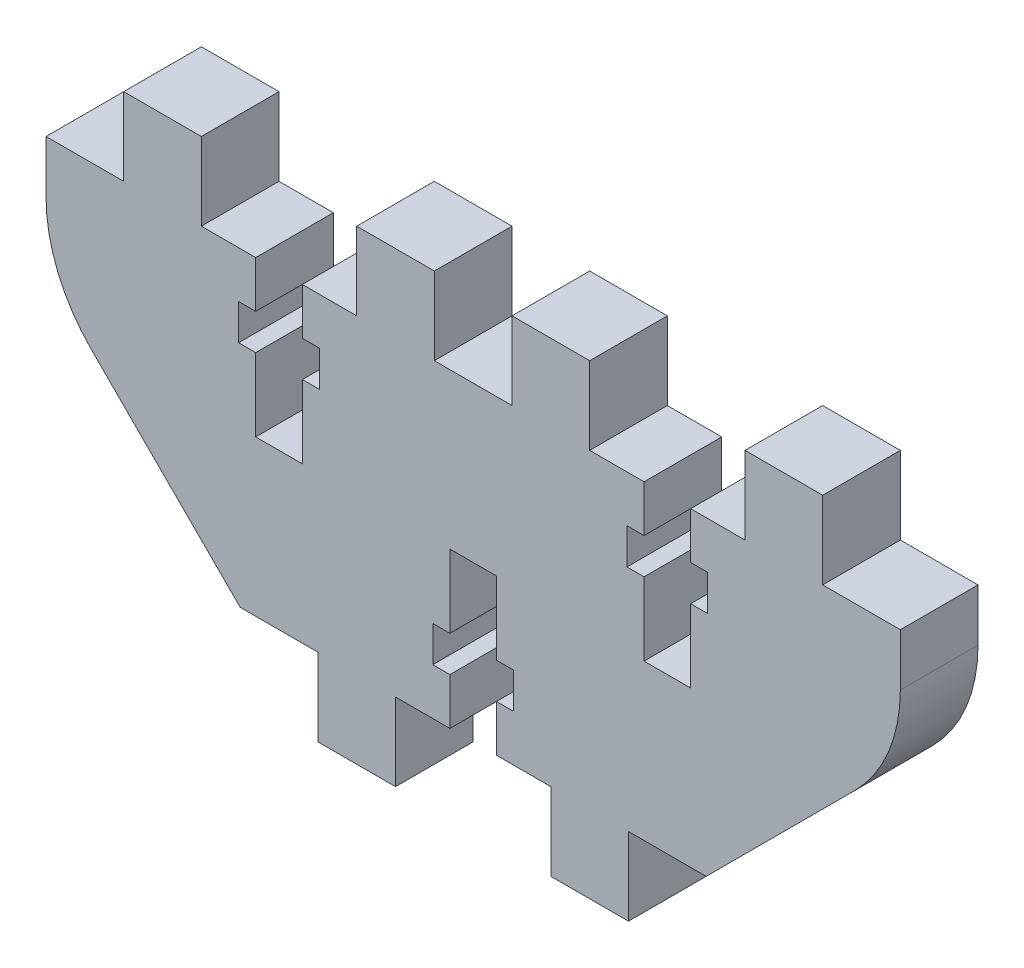
from build123d import *

# Parameters (mm, degrees)
BOSS_EXTRU_1_DEPTH = 5
CONG_1_R           = 10


with BuildPart() as part:
    # Esquisse1 → Boss.-Extru.1 (new body)
    with BuildSketch(Plane.XY):
        Polygon((10, 0), (15, 0), (27.5, 12.5), (27.5, 20), (22.5, 20), (22.5, 25), (17.5, 25), (17.5, 20), (14, 20), (14, 17), (15.1, 17), (15.1, 14.7), (14, 14.7), (14, 10), (11, 10), (11, 14.7), (9.9, 14.7), (9.9, 17), (11, 17), (11, 20), (7.5, 20), (7.5, 25), (2.5, 25), (2.5, 20), (-2.5, 20), (-2.5, 25), (-7.5, 25), (-7.5, 20), (-11, 20), (-11, 17), (-9.9, 17), (-9.9, 14.7), (-11, 14.7), (-11, 10), (-14, 10), (-14, 14.7), (-15.1, 14.7), (-15.1, 17), (-14, 17), (-14, 20), (-17.5, 20), (-17.5, 25), (-22.5, 25), (-22.5, 20), (-27.5, 20), (-27.5, 12.5), (-15, 0), (-10, 0), (-10, -5), (-5, -5), (-5, 0), (-1.5, 0), (-1.5, 3), (-2.6, 3), (-2.6, 5.3), (-1.5, 5.3), (-1.5, 10), (1.5, 10), (1.5, 5.3), (2.6, 5.3), (2.6, 3), (1.5, 3), (1.5, 0), (5, 0), (5, -5), (10, -5), align=None)
    extrude(amount=BOSS_EXTRU_1_DEPTH)

    # Congé1
    cong_1_edges = [part.edges().sort_by_distance(p)[0] for p in [
        (-27.5, 12.5, 2.5),
        (27.5, 12.5, 2.5),
    ]]
    fillet(cong_1_edges, radius=CONG_1_R)


solid = part.part
